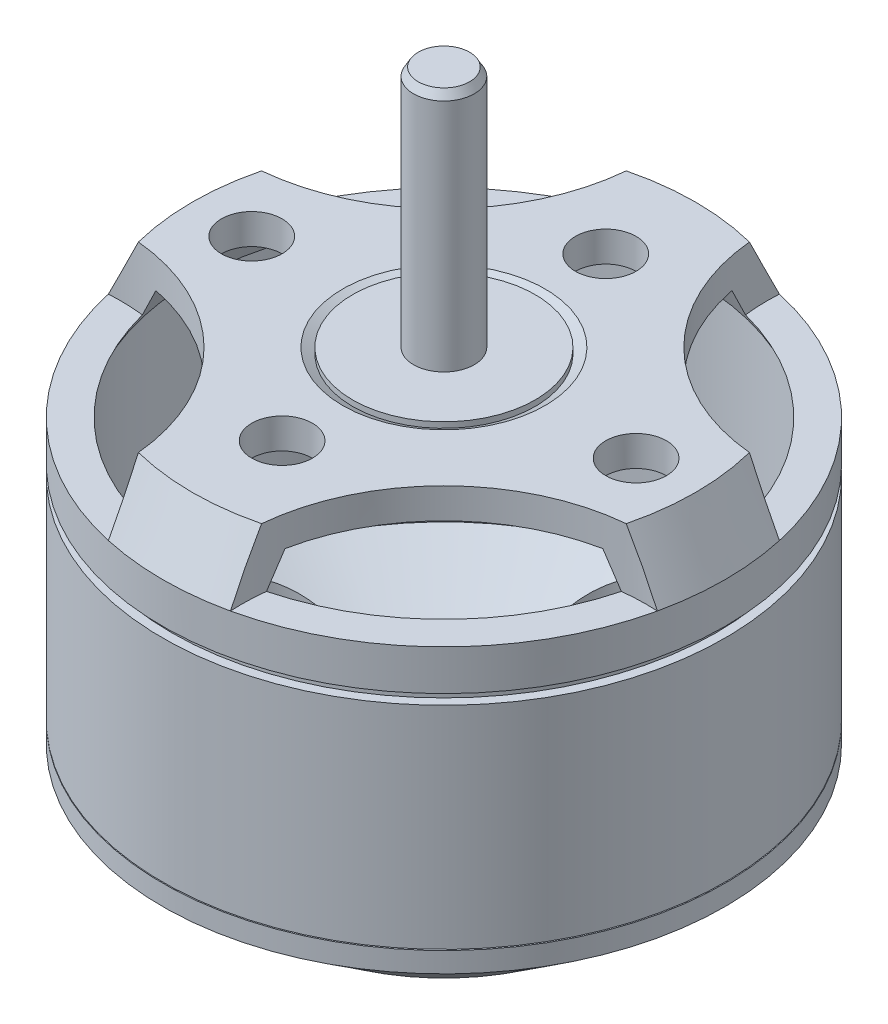
from build123d import *

# Parameters (mm, degrees)
SKETCH_1_R               = 13.9
EXTRUDE_1_DEPTH          = 21
CHAMFER_1_SIZE           = 3
CHAMFER_1_SIZE2          = 1.463197766
CHAMFER_3_SIZE           = 5.4
CHAMFER_3_SIZE2          = 4
SHELL_1_T                = 1.5
SKETCH_2_R               = 4.75
EXTRUDE_2_DEPTH          = 2
SKETCH_4_R               = 1.6
EXTRUDE_3_DEPTH          = 0.3
SKETCH_5_R               = 3.75
CUT_EXTRUDE_1_DEPTH      = 7
PATTERN_CIRCULAR_1_COUNT = 4
SKETCH_6_R               = 1.5
CUT_EXTRUDE_2_DEPTH      = 5
PATTERN_CIRCULAR_2_COUNT = 2
SKETCH_7_R               = 4
CUT_EXTRUDE_3_DEPTH      = 1
CHAMFER_4_SIZE           = 1
CHAMFER_4_SIZE2          = 0.577350269
SKETCH_8_R               = 4.512267411
EXTRUDE_4_DEPTH          = 1
SKETCH_9_R               = 1.5
EXTRUDE_5_DEPTH          = 12
CHAMFER_5_SIZE           = 0.4
CHAMFER_5_SIZE_2         = 0.230940108
SKETCH_10_W              = 0.893787206
SKETCH_10_H              = 0.5
SKETCH_10_W_2            = 7.851604488
SKETCH_10_H_2            = 0.05
SKETCH_11_R              = 10
CUT_EXTRUDE_4_DEPTH      = 3
PATTERN_CIRCULAR_3_COUNT = 4


with BuildPart() as part:
    # 草图1 → 凸台-拉伸1 (new body)
    with BuildSketch(Plane(origin=(0, 0, 0), x_dir=(1, 0, 0), z_dir=(0, 1, 0))):
        with Locations(Location((0, 0, 0), (0, 0, 90))):
            Circle(SKETCH_1_R)
    extrude(amount=EXTRUDE_1_DEPTH)

    # 倒角1
    chamfer_1_edges = [part.edges().sort_by_distance(p)[0] for p in [
        (0, 21, 13.9),
    ]]
    chamfer_1_side = [part.faces().sort_by_distance(p)[0] for p in [
        (0, 10.5, 13.9),
    ]]
    chamfer(chamfer_1_edges, length=CHAMFER_1_SIZE, length2=CHAMFER_1_SIZE2, reference=chamfer_1_side[0])

    # 倒角3
    chamfer_3_edges = [part.edges().sort_by_distance(p)[0] for p in [
        (0, 0, 13.9),
    ]]
    chamfer_3_side = [part.faces().sort_by_distance(p)[0] for p in [
        (0, 0, 0),
    ]]
    chamfer(chamfer_3_edges, length=CHAMFER_3_SIZE, length2=CHAMFER_3_SIZE2, reference=chamfer_3_side[0])

    # 抽壳1 (no face opened: a closed hollow body)
    add(offset(amount=-SHELL_1_T, mode=Mode.PRIVATE), mode=Mode.SUBTRACT)

    # 草图2 → 凸台-拉伸2 (add)
    with BuildSketch(Plane.XZ):
        with Locations(Location((0, 0, 0), (0, 0, 90))):
            Circle(SKETCH_2_R)
    extrude(amount=EXTRUDE_2_DEPTH)

    # 草图4 → 凸台-拉伸3 (add)
    with BuildSketch(Plane.XZ.offset(2)):
        with Locations(Location((0, 0, 0), (0, 0, 270))):
            Circle(SKETCH_4_R)
    extrude(amount=EXTRUDE_3_DEPTH)

    # 草图5 → 切除-拉伸1 (cut)
    with BuildSketch(Plane.XZ):
        with Locations(Location((0, 8.5, 0), (0, 0, 270.000312794))):
            Circle(SKETCH_5_R)
    cut_extrude_1 = extrude(amount=-CUT_EXTRUDE_1_DEPTH, mode=Mode.SUBTRACT)

    # 阵列(圆周)1: 切除-拉伸1 ×4 about axis
    pattern_circular_1_axis = Axis((0, 0, 0), (0, 1, 0))
    for i in range(1, PATTERN_CIRCULAR_1_COUNT):
        add(cut_extrude_1.rotate(pattern_circular_1_axis, i * 360 / PATTERN_CIRCULAR_1_COUNT), mode=Mode.SUBTRACT)

    # 草图6 → 切除-拉伸2 (cut)
    with BuildSketch(Plane(origin=(0, 21, 0), x_dir=(1, 0, 0), z_dir=(0, 1, 0))):
        with Locations(Location((0, 8, 0), (0, 0, 270))):
            Circle(SKETCH_6_R)
        with Locations(Location((-9.5, 0, 0), (0, 0, 270))):
            Circle(SKETCH_6_R)
    cut_extrude_2 = extrude(amount=-CUT_EXTRUDE_2_DEPTH, mode=Mode.SUBTRACT)

    # 阵列(圆周)2: 切除-拉伸2 ×2 about axis
    pattern_circular_2_axis = Axis((0, 0, 0), (0, 1, 0))
    for i in range(1, PATTERN_CIRCULAR_2_COUNT):
        add(cut_extrude_2.rotate(pattern_circular_2_axis, i * 360 / PATTERN_CIRCULAR_2_COUNT), mode=Mode.SUBTRACT)

    # 草图7 → 切除-拉伸3 (cut)
    with BuildSketch(Plane(origin=(0, 21, 0), x_dir=(1, 0, 0), z_dir=(0, 1, 0))):
        with Locations(Location((0, 0, 0), (0, 0, 270))):
            Circle(SKETCH_7_R)
    extrude(amount=-CUT_EXTRUDE_3_DEPTH, mode=Mode.SUBTRACT)

    # 倒角4
    chamfer_4_edges = [part.edges().sort_by_distance(p)[0] for p in [
        (0, 21, -4),
    ]]
    chamfer_4_side = [part.faces().sort_by_distance(p)[0] for p in [
        (0, 21, 12.085036346),
    ]]
    chamfer(chamfer_4_edges, length=CHAMFER_4_SIZE, length2=CHAMFER_4_SIZE2, reference=chamfer_4_side[0])

    # 草图8 → 凸台-拉伸4 (add)
    with BuildSketch(Plane(origin=(0, 20, 0), x_dir=(1, 0, 0), z_dir=(0, 1, 0))):
        with Locations(Location((0, 0, 0), (0, 0, 270))):
            Circle(SKETCH_8_R)
    extrude(amount=EXTRUDE_4_DEPTH)

    # 草图9 → 凸台-拉伸5 (add)
    with BuildSketch(Plane(origin=(0, 21, 0), x_dir=(1, 0, 0), z_dir=(0, 1, 0))):
        with Locations(Location((0, 0, 0), (0, 0, 270))):
            Circle(SKETCH_9_R)
    extrude(amount=EXTRUDE_5_DEPTH)

    # 倒角5
    # the kernel refuses this chamfer: 0.4, 0.230940108 mm, written as the material it takes off along each edge
    with BuildSketch(Plane(origin=(0, -2.3, 0), x_dir=(0, 0, -1), z_dir=(-1, 0, 0))) as chamfer_5_piece_1_section:
        Polygon((1.6, -CHAMFER_5_SIZE), (1.6 - CHAMFER_5_SIZE_2 * 0.999999998596, 0), (1.6, 0), align=None)
    chamfer_5_piece_1 = revolve(axis=Axis((0, -2.3, 0), (0, -1, 0)), mode=Mode.PRIVATE)
    chamfer_5_piece_1 = split(chamfer_5_piece_1, bisect_by=Plane(origin=(0, -2, 1.458345523), z_dir=(0, -1, 0)), keep=Keep.TOP, mode=Mode.PRIVATE)
    add(chamfer_5_piece_1, mode=Mode.SUBTRACT)
    with BuildSketch(Plane(origin=(0, 33, 0), x_dir=(0, 0, 1), z_dir=(-1, 0, 0))) as chamfer_5_piece_2:
        Polygon((1.5, -CHAMFER_5_SIZE), (1.5 - CHAMFER_5_SIZE_2 * 0.999999998596, 0), (1.5, 0), align=None)
    revolve(axis=Axis((0, 33, 0), (0, 1, 0)), mode=Mode.SUBTRACT)

    # 草图10 → 切除-旋转1 (revolve, cut)
    with BuildSketch(Plane.XY, mode=Mode.PRIVATE) as cut_revolve_1_sk:
        with Locations((13.9, 15.75)):
            Rectangle(SKETCH_10_W, SKETCH_10_H)
        with Locations((13.9, 5.025)):
            Rectangle(SKETCH_10_W_2, SKETCH_10_H_2)
    revolve(cut_revolve_1_sk.sketch.rotate(Axis((0, 33.883768899, 0), (0, -1, 0)), 270), axis=Axis((0, 33.883768899, 0), (0, -1, 0)), mode=Mode.SUBTRACT)


with BuildPart() as cut_revolve_1_piece_1:
    # of the separate pieces the step leaves, piece 1, a body of its own (cut_revolve_1_pieces)
    add(part.part.solids().sort_by_distance((0, 21, 5))[0])

    # 草图11 → 切除-拉伸4 (cut)
    with BuildSketch(Plane(origin=(0, 21, 0), x_dir=(1, 0, 0), z_dir=(0, 1, 0))):
        with Locations((-13, 13)):
            Circle(SKETCH_11_R)
    cut_extrude_4 = extrude(amount=-CUT_EXTRUDE_4_DEPTH, mode=Mode.SUBTRACT)

    # 阵列(圆周)3: 切除-拉伸4 ×4 about axis
    pattern_circular_3_axis = Axis((0, 0, 0), (0, 1, 0))
    for i in range(1, PATTERN_CIRCULAR_3_COUNT):
        add(cut_extrude_4.rotate(pattern_circular_3_axis, i * 360 / PATTERN_CIRCULAR_3_COUNT), mode=Mode.SUBTRACT)


with BuildPart() as cut_revolve_1_piece_2:
    # of the separate pieces the step leaves, piece 2, a body of its own (cut_revolve_1_pieces)
    add(part.part.solids().sort_by_distance((0, 4, -13.9))[0])


solid = Compound([cut_revolve_1_piece_1.part, cut_revolve_1_piece_2.part])
